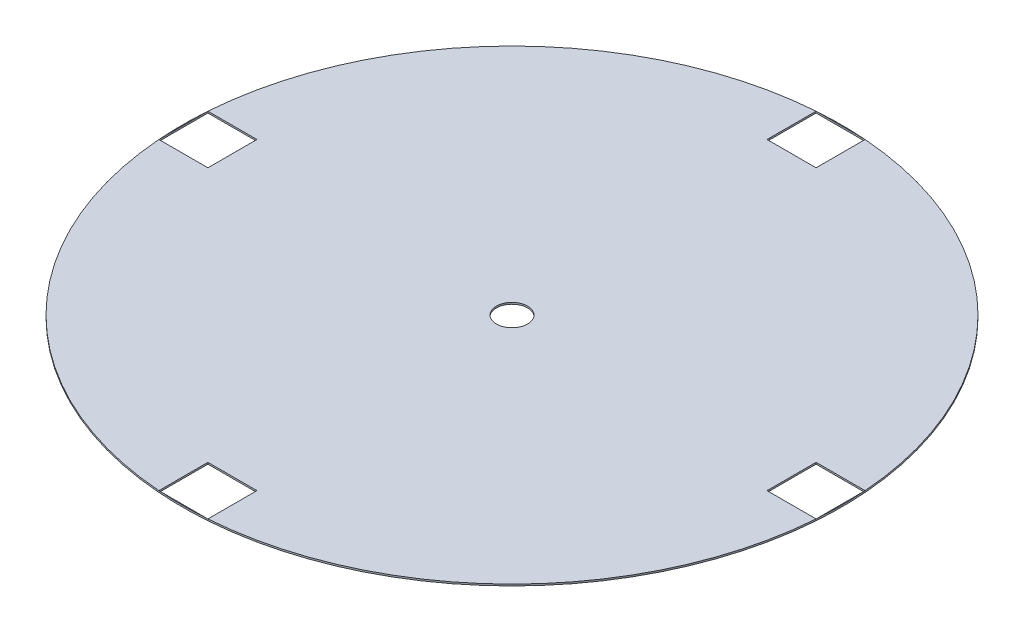
from build123d import *

# Parameters (mm, degrees)
CROQUIS1_R              = 403.28
CROQUIS1_R_2            = 19.05
SALIENTE_EXTRUIR1_DEPTH = 2
CROQUIS3_W              = 60
CROQUIS3_H              = 60
CORTAR_EXTRUIR1_DEPTH   = 571.327552201


with BuildPart() as part:
    # Croquis1 → Saliente-Extruir1 (new body)
    with BuildSketch(Plane(origin=(0, 0, 0), x_dir=(1, 0, 0), z_dir=(0, 1, 0))):
        Circle(CROQUIS1_R)
        Circle(CROQUIS1_R_2, mode=Mode.SUBTRACT)
    extrude(amount=SALIENTE_EXTRUIR1_DEPTH)

    # Croquis3 → Cortar-Extruir1 (cut, through all)
    with BuildSketch(Plane(origin=(0, 2, 0), x_dir=(1, 0, 0), z_dir=(0, 1, 0))):
        with Locations((372.162601941, 0)):
            Rectangle(CROQUIS3_W, CROQUIS3_H)
        with Locations((0, -372.162601941)):
            Rectangle(CROQUIS3_W, CROQUIS3_H)
        with Locations((-372.162601941, 0)):
            Rectangle(CROQUIS3_W, CROQUIS3_H)
        with Locations((0, 372.162601941)):
            Rectangle(CROQUIS3_W, CROQUIS3_H)
    extrude(amount=-CORTAR_EXTRUIR1_DEPTH, mode=Mode.SUBTRACT)


solid = part.part
